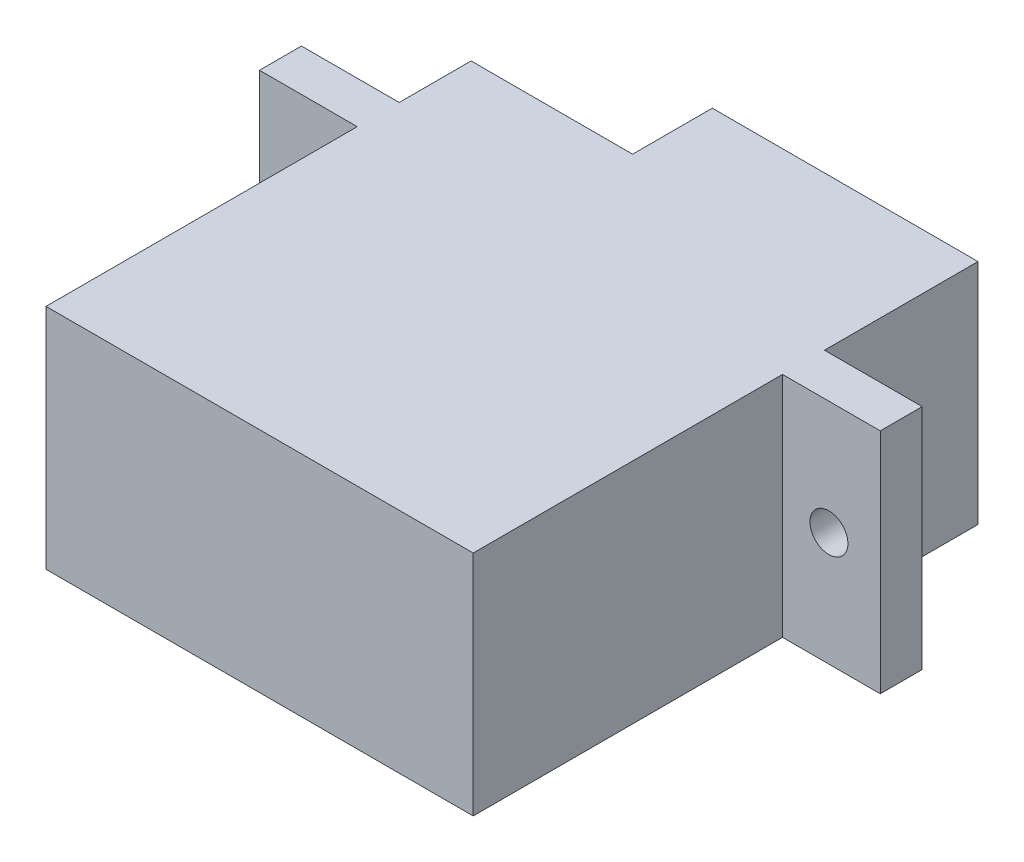
from build123d import *

# Parameters (mm, degrees)
BOSS_EXTRUDE1_DEPTH = 12
SKETCH4_R           = 2.4
BOSS_EXTRUDE3_DEPTH = 2.5
SKETCH6_R           = 1
CUT_EXTRUDE1_DEPTH  = 42.903288654


with BuildPart() as part:
    # Sketch1 → Boss-Extrude1 (new body)
    with BuildSketch(Plane(origin=(0, 0, 0), x_dir=(1, 0, 0), z_dir=(0, 1, 0))):
        Polygon((0, 0), (0, 16.4), (-5.15, 16.4), (-5.15, 18.61), (0, 18.61), (0, 22.4), (8.51, 22.4), (8.51, 26.6), (22.51, 26.6), (22.51, 18.51), (27.66, 18.51), (27.66, 16.3), (22.51, 16.3), (22.51, 0), align=None)
    extrude(amount=BOSS_EXTRUDE1_DEPTH)

    # Sketch4 → Boss-Extrude3 (add)
    with BuildSketch(Plane(origin=(0, 0, -26.6), x_dir=(-1, 0, 0), z_dir=(0, 0, -1))):
        with Locations((-17.01, 6)):
            Circle(SKETCH4_R)
    extrude(amount=BOSS_EXTRUDE3_DEPTH)

    # Sketch6 → Cut-Extrude1 (cut, through all)
    with BuildSketch(Plane.XY):
        with Locations((24.955, 6)):
            Circle(SKETCH6_R)
        with Locations((-2.445, 6)):
            Circle(SKETCH6_R)
    extrude(amount=-CUT_EXTRUDE1_DEPTH, mode=Mode.SUBTRACT)


solid = part.part
